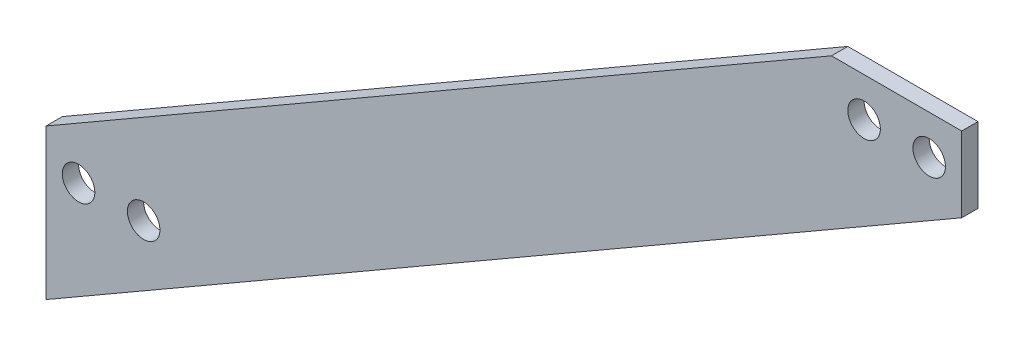
from build123d import *

# Parameters (mm, degrees)
SKETCH1_R           = 4.7625
BOSS_EXTRUDE1_DEPTH = 4.7625


with BuildPart() as part:
    # Sketch1 → Boss-Extrude1 (new body)
    with BuildSketch(Plane.XY):
        Polygon((0, 0), (0, -43.994090512), (267.97, 110.718461122), (267.97, 132.715506379), (229.87, 132.715506379), align=None)
        with Locations((9.525, -9.704090512)):
            Circle(SKETCH1_R, mode=Mode.SUBTRACT)
        with Locations((28.575, -9.704090512)):
            Circle(SKETCH1_R, mode=Mode.SUBTRACT)
        with Locations((239.395, 121.285506379)):
            Circle(SKETCH1_R, mode=Mode.SUBTRACT)
        with Locations((258.445, 121.285506379)):
            Circle(SKETCH1_R, mode=Mode.SUBTRACT)
    extrude(amount=BOSS_EXTRUDE1_DEPTH)


solid = part.part
